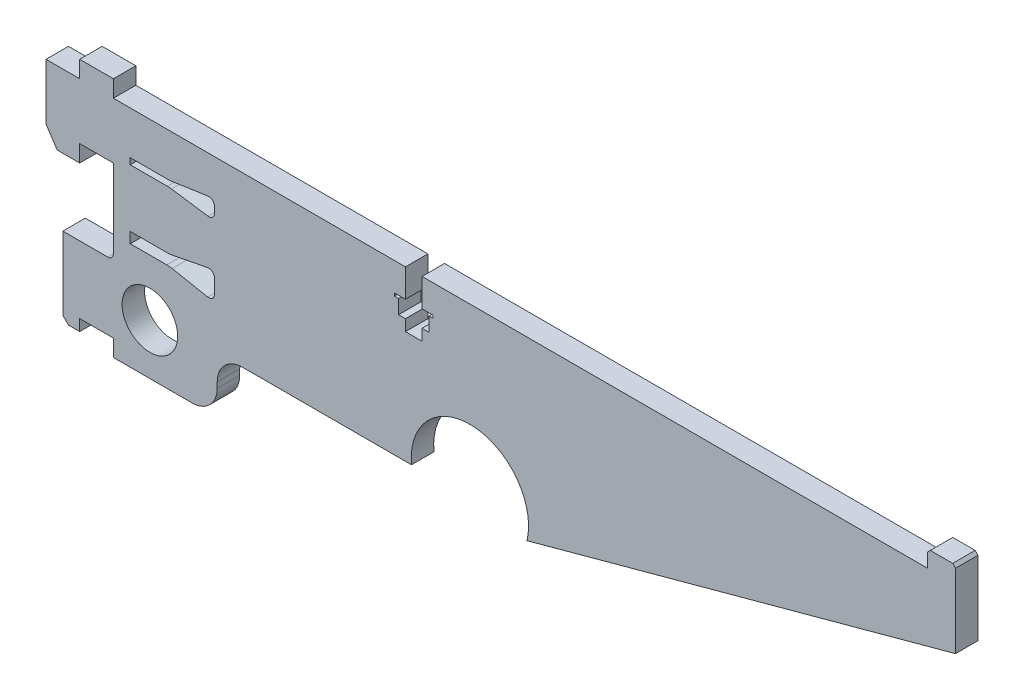
from build123d import *

# Parameters (mm, degrees)
SKETCH1_R           = 4.949747468
BOSS_EXTRUDE1_DEPTH = 4
CHAMFER1_SIZE       = 3
CHAMFER1_SIZE2      = 2
FILLET1_R           = 1
FILLET2_R           = 5
CHAMFER2_SIZE       = 0.5
CHAMFER3_SIZE       = 1
FILLET3_R           = 1
SKETCH2_W           = 44.364666687
SKETCH2_H           = 10
CUT_EXTRUDE1_DEPTH  = 168.994791586
FILLET4_R           = 4.5


with BuildPart() as part:
    # Sketch1 → Boss-Extrude1 (new body)
    with BuildSketch(Plane.XY):
        with BuildLine():
            Line((7.5, -7), (16.5, -7))
            Line((16.5, -7), (16.5, 8))
            Line((16.5, 8), (10.5, 8))
            Line((10.5, 8), (10.5, 5))
            Line((10.5, 5), (4.5, 5))
            Line((4.5, 5), (4.5, 18))
            Line((4.5, 18), (10.5, 18))
            Line((10.5, 18), (10.5, 21))
            Line((10.5, 21), (16.5, 21))
            Line((16.5, 21), (16.5, 18))
            Line((16.5, 18), (68.52, 18))
            Line((68.52, 18), (68.52, 13))
            Line((68.52, 13), (66.55, 13))
            Line((66.55, 13), (66.55, 12.5))
            Line((66.55, 12.5), (67.3, 12.5))
            Line((67.3, 12.5), (67.3, 10))
            Line((67.3, 10), (68.52, 10))
            Line((68.52, 10), (68.52, 8))
            Line((68.52, 8), (71.48, 8))
            Line((71.48, 8), (71.48, 10))
            Line((71.48, 10), (72.7, 10))
            Line((72.7, 10), (72.7, 12.5))
            Line((72.7, 12.5), (73.45, 12.5))
            Line((73.45, 12.5), (73.45, 13))
            Line((73.45, 13), (71.48, 13))
            Line((71.48, 13), (71.48, 18))
            Line((71.48, 18), (161.5, 18))
            Line((161.5, 18), (161.5, 21))
            Line((161.5, 21), (166.5, 21))
            Line((166.5, 21), (166.5, 7.320432567))
            Line((166.5, 7.320432567), (90.166126815, -13.419166297))
            ThreePointArc((90.166126815, -13.419166297), (77.260105301, -0.915582464), (72.455781987, -18.230994024))
            Line((72.455781987, -18.230994024), (58.583632093, -22))
            Line((58.583632093, -22), (16.5, -22))
            Line((16.5, -22), (16.5, -19))
            Line((16.5, -19), (10.5, -19))
            Line((10.5, -19), (10.5, -21))
            Line((10.5, -21), (7.5, -21))
            Line((7.5, -21), (7.5, -7))
        make_face()
        with Locations((23, -13)):
            Circle(SKETCH1_R, mode=Mode.SUBTRACT)
        Polygon((19.5, -2.95), (19.5, -1.05), (26.5, -1.05), (34.5, 0.5), (34.5, -4.5), (26.5, -2.95), align=None, mode=Mode.SUBTRACT)
        Polygon((19.5, 9.226722117), (19.5, 10.326722117), (26.5, 10.326722117), (34.5, 11.487607038), (34.5, 8.065837195), (26.5, 9.226722117), align=None, mode=Mode.SUBTRACT)
    extrude(amount=BOSS_EXTRUDE1_DEPTH)

    # Chamfer1
    chamfer1_edges = [part.edges().sort_by_distance(p)[0] for p in [
        (4.5, 5, 2),
    ]]
    chamfer1_side = [part.faces().sort_by_distance(p)[0] for p in [
        (4.5, 11.5, 2),
    ]]
    chamfer(chamfer1_edges, length=CHAMFER1_SIZE, length2=CHAMFER1_SIZE2, reference=chamfer1_side[0])

    # Fillet1
    fillet1_edges = [part.edges().sort_by_distance(p)[0] for p in [
        (34.5, -4.5, 2),
        (34.5, 0.5, 2),
        (34.5, 8.065837195, 2),
        (34.5, 11.487607038, 2),
    ]]
    fillet(fillet1_edges, radius=FILLET1_R)

    # Fillet2
    fillet2_edges = [part.edges().sort_by_distance(p)[0] for p in [
        (26.5, -1.05, 2),
        (26.5, -2.95, 2),
        (26.5, 9.226722117, 2),
        (26.5, 10.326722117, 2),
    ]]
    fillet(fillet2_edges, radius=FILLET2_R)

    # Chamfer2
    chamfer2_edges = [part.edges().sort_by_distance(p)[0] for p in [
        (166.5, 21, 2),
        (161.5, 21, 2),
    ]]
    chamfer(chamfer2_edges, length=CHAMFER2_SIZE)

    # Chamfer3
    chamfer3_edges = [part.edges().sort_by_distance(p)[0] for p in [
        (7.5, -21, 2),
    ]]
    chamfer(chamfer3_edges, length=CHAMFER3_SIZE)

    # Fillet3
    fillet3_edges = [part.edges().sort_by_distance(p)[0] for p in [
        (16.5, -7, 2),
    ]]
    fillet(fillet3_edges, radius=FILLET3_R)

    # Sketch2 → Cut-Extrude1 (cut, through all)
    with BuildSketch(Plane.XY.offset(4)):
        with Locations((57.182333344, -17)):
            Rectangle(SKETCH2_W, SKETCH2_H)
    extrude(amount=-CUT_EXTRUDE1_DEPTH, mode=Mode.SUBTRACT)

    # Fillet4
    fillet4_edges = [part.edges().sort_by_distance(p)[0] for p in [
        (35, -12, 2),
        (35, -22, 2),
    ]]
    fillet(fillet4_edges, radius=FILLET4_R)


solid = part.part
